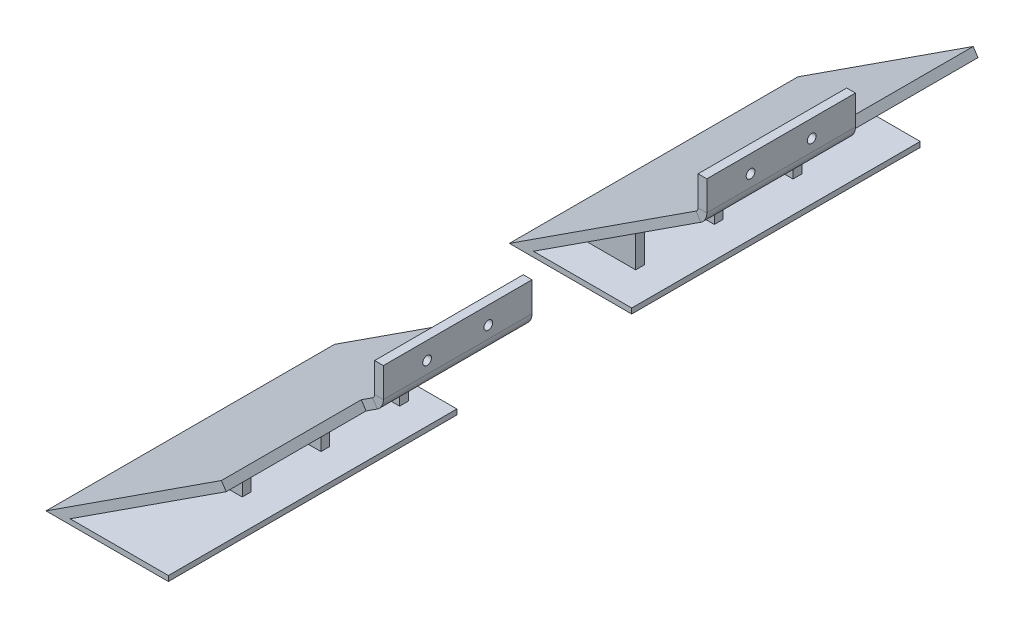
from build123d import *

# Parameters (mm, degrees)
BASE_FLANGE2_DEPTH   = 430
CUT_EXTRUDE1_START   = 165
CUT_EXTRUDE1_DEPTH   = 100
CUT_EXTRUDE1_2_DEPTH = 80
CUT_EXTRUDE1_START_2 = 350
CUT_EXTRUDE1_3_DEPTH = 80
BOSS_EXTRUDE2_DEPTH  = 430
BOSS_EXTRUDE3_START  = 50
BOSS_EXTRUDE3_DEPTH  = 5
LPATTERN1_COUNT      = 8
LPATTERN1_PITCH      = 45
SKETCH13_R           = 2.5
CUT_EXTRUDE2_DEPTH   = 5
SKETCH14_W           = 88.914799092
SKETCH14_H           = 100
CUT_EXTRUDE3_DEPTH   = 440.40419449


# Read off the part's stored shape, not the designer's step: Cut-Extrude1
# Sheet-metal steps are written as plain solids
with BuildPart() as part:
    # Sketch1 → Base-Flange2 (new body)
    with BuildSketch(Plane.XY):
        with BuildLine():
            Line((27.921955125, 53.363555481), (27.921955125, 36.487969417))
            ThreePointArc((27.921955125, 36.487969417), (27.001720358, 32.862954046), (24.463866589, 30.115797933))
            Line((24.463866589, 30.115797933), (-72.078044875, -32.636444519))
            Line((-72.078044875, -32.636444519), (-74.802986628, -28.444226438))
            Line((-74.802986628, -28.444226438), (21.738924836, 34.308016014))
            ThreePointArc((21.738924836, 34.308016014), (22.607137968, 35.24783258), (22.921955125, 36.487969417))
            Line((22.921955125, 36.487969417), (22.921955125, 53.363555481))
            Line((22.921955125, 53.363555481), (27.921955125, 53.363555481))
        make_face()
    extrude(amount=BASE_FLANGE2_DEPTH)

    # Cut-Extrude1 outline → Cut-Extrude1 (cut)
    with BuildSketch(Plane.XY.offset(CUT_EXTRUDE1_START)):
        with BuildLine():
            Line((21.738924836, 34.308016014), (-10.483322138, 13.363555481))
            Line((-10.483322138, 13.363555481), (-7.758380385, 9.171337399))
            Line((-7.758380385, 9.171337399), (24.463866589, 30.115797933))
            ThreePointArc((24.463866589, 30.115797933), (27.001720358, 32.862954046), (27.921955125, 36.487969417))
            Line((27.921955125, 36.487969417), (27.921955125, 53.363555481))
            Line((27.921955125, 53.363555481), (22.921955125, 53.363555481))
            Line((22.921955125, 53.363555481), (22.921955125, 36.487969417))
            ThreePointArc((22.921955125, 36.487969417), (22.607137968, 35.247832579), (21.738924836, 34.308016014))
        make_face()
    extrude(amount=CUT_EXTRUDE1_DEPTH, mode=Mode.SUBTRACT)

    # Cut-Extrude1 2 outline → Cut-Extrude1 2 (cut)
    with BuildSketch(Plane.XY):
        with BuildLine():
            Line((21.738924836, 34.308016014), (15.289358557, 30.115797933))
            Line((15.289358557, 30.115797933), (18.01430031, 25.923579851))
            Line((18.01430031, 25.923579851), (24.463866589, 30.115797933))
            ThreePointArc((24.463866589, 30.115797933), (27.001720358, 32.862954046), (27.921955125, 36.487969417))
            Line((27.921955125, 36.487969417), (27.921955125, 53.363555481))
            Line((27.921955125, 53.363555481), (22.921955125, 53.363555481))
            Line((22.921955125, 53.363555481), (22.921955125, 36.487969417))
            ThreePointArc((22.921955125, 36.487969417), (22.607137968, 35.247832579), (21.738924836, 34.308016014))
        make_face()
    extrude(amount=CUT_EXTRUDE1_2_DEPTH, mode=Mode.SUBTRACT)

    # Cut-Extrude1 3 outline → Cut-Extrude1 3 (cut)
    with BuildSketch(Plane.XY.offset(CUT_EXTRUDE1_START_2)):
        with BuildLine():
            Line((21.738924836, 34.308016014), (15.289358557, 30.115797933))
            Line((15.289358557, 30.115797933), (18.01430031, 25.923579851))
            Line((18.01430031, 25.923579851), (24.463866589, 30.115797933))
            ThreePointArc((24.463866589, 30.115797933), (27.001720358, 32.862954046), (27.921955125, 36.487969417))
            Line((27.921955125, 36.487969417), (27.921955125, 53.363555481))
            Line((27.921955125, 53.363555481), (22.921955125, 53.363555481))
            Line((22.921955125, 53.363555481), (22.921955125, 36.487969417))
            ThreePointArc((22.921955125, 36.487969417), (22.607137968, 35.247832579), (21.738924836, 34.308016014))
        make_face()
    extrude(amount=CUT_EXTRUDE1_3_DEPTH, mode=Mode.SUBTRACT)

    # Sketch11 → Boss-Extrude2 (add)
    with BuildSketch(Plane.XY.offset(430)):
        Polygon((-74.802986628, -28.444226438), (-85.033367831, -35.09397422), (-15.033367831, -35.09397422), (-15.033367831, -32.09397422), (-71.243475184, -32.09397422), (-72.078044875, -32.636444519), align=None)
    extrude(amount=-BOSS_EXTRUDE2_DEPTH)

    # Sketch12 → Boss-Extrude3 (add)
    with BuildSketch(Plane.XY.offset(BOSS_EXTRUDE3_START)):
        Polygon((-32.781936722, -7.09397422), (-32.781936722, -32.09397422), (-71.243475184, -32.09397422), align=None)
    boss_extrude3 = extrude(amount=BOSS_EXTRUDE3_DEPTH)

    # LPattern1: Boss-Extrude3 ×8
    with Locations(*[(0, 0, i * LPATTERN1_PITCH) for i in range(1, LPATTERN1_COUNT)]):
        add(boss_extrude3)

    # Sketch13 → Cut-Extrude2 (cut)
    with BuildSketch(Plane.ZY.offset(-22.921955125)):
        with Locations((325, 43.363555481)):
            Circle(SKETCH13_R)
        with Locations((290, 43.363555481)):
            Circle(SKETCH13_R)
        with Locations(Location((140, 43.363555481, 0), (0, 0, 180))):
            Circle(SKETCH13_R)
        with Locations(Location((105, 43.363555481, 0), (0, 0, 180))):
            Circle(SKETCH13_R)
    extrude(amount=-CUT_EXTRUDE2_DEPTH, mode=Mode.SUBTRACT)

    # Sketch14 → Cut-Extrude3 (cut, through all)
    with BuildSketch(Plane(origin=(-9.220045459, 14.184685322, 0), x_dir=(0.8384436163006371, 0.5449883505954143, 0), z_dir=(-0.5449883505954142, 0.838443616300637, 0))):
        with Locations((-45.964092011, -215)):
            Rectangle(SKETCH14_W, SKETCH14_H)
    extrude(amount=-CUT_EXTRUDE3_DEPTH, mode=Mode.SUBTRACT)


with BuildPart() as cut_extrude3_piece_1:
    # of the separate pieces the step leaves, piece 1, a body of its own (cut_extrude3_pieces)
    add(part.part.solids().sort_by_distance((22.921955125, 53.363555481, 80))[0])


with BuildPart() as cut_extrude3_piece_2:
    # of the separate pieces the step leaves, piece 2, a body of its own (cut_extrude3_pieces)
    add(part.part.solids().sort_by_distance((21.738924836, 34.308016014, 265))[0])


solid = Compound([cut_extrude3_piece_1.part, cut_extrude3_piece_2.part])
